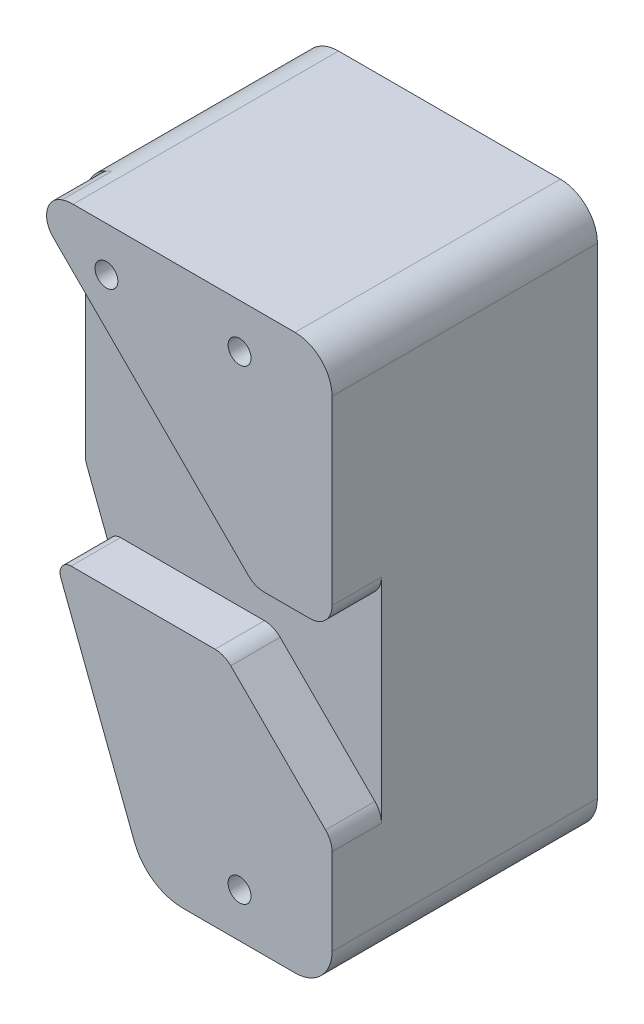
from build123d import *
from build123d.topology import SkipClean

# Parameters (mm, degrees)
SKETCH1_R           = 1.5
SKETCH1_W           = 15
SKETCH1_H           = 37.5
BOSS_EXTRUDE1_DEPTH = 2.85
FILLET1_R           = 5
FILLET2_R           = 2
BOSS_EXTRUDE2_START = 3.5
SKETCH5_R           = 1.5
BOSS_EXTRUDE2_DEPTH = 3.5
FILLET3_R           = 3.5
FILLET4_R           = 2
FILLET5_R           = 2
SKETCH6_R           = 1.5
CUT_EXTRUDE1_DEPTH  = 10
SKETCH8_R           = 1.5
BOSS_EXTRUDE3_DEPTH = 6.35
BOSS_EXTRUDE4_START = 3.175
SKETCH9_R           = 1.5
BOSS_EXTRUDE4_DEPTH = 3.175
SKETCH10_W          = 40
SKETCH10_H          = 15.399494937
SKETCH10_W_2        = 25
BOSS_EXTRUDE5_DEPTH = 6.675
CUT_EXTRUDE2_START  = -6.675
CUT_EXTRUDE2_DEPTH  = 6.675
BOSS_EXTRUDE6_START = -9.2
BOSS_EXTRUDE6_DEPTH = 9.2
FILLET6_R           = 7
BOSS_EXTRUDE7_DEPTH = 6.675
FILLET7_R           = 3
FILLET8_R           = 1.5
SKETCH14_R          = 1.5
CUT_EXTRUDE3_DEPTH  = 81.63507689
SKETCH15_R          = 1.55
CUT_EXTRUDE4_DEPTH  = 81.63507689
BOSS_EXTRUDE8_START = 20
SKETCH16_R          = 1.55
BOSS_EXTRUDE8_DEPTH = 20


# Read off the part's stored shape, not the designer's step: Cut-Extrude2
with BuildPart() as part:
    # Sketch1 → Boss-Extrude1 (new body)
    # profile 1 of 2: a face of its own
    with BuildSketch(Plane.XY):
        Polygon((0, 37.5), (0, 0), (25, 0), (25, 75), (0, 75), align=None)
        with Locations((12.5, 6)):
            Circle(SKETCH1_R, mode=Mode.SUBTRACT)
        with Locations((12.5, 37.5)):
            Circle(SKETCH1_R, mode=Mode.SUBTRACT)
        with Locations((12.5, 69)):
            Circle(SKETCH1_R, mode=Mode.SUBTRACT)
    # profile 2 of 2: a face of its own
    with BuildSketch(Plane.XY):
        with Locations((-7.5, 56.25)):
            Rectangle(SKETCH1_W, SKETCH1_H)
    extrude(amount=BOSS_EXTRUDE1_DEPTH)

    # Fillet1
    fillet1_edges = [part.edges().sort_by_distance(p)[0] for p in [
        (25, 75, 1.425),
        (25, 0, 1.425),
        (0, 0, 1.425),
        (0, 37.5, 1.425),
        (-15, 75, 1.425),
    ]]
    fillet(fillet1_edges, radius=FILLET1_R)

    # Fillet2
    fillet2_edges = [part.edges().sort_by_distance(p)[0] for p in [
        (-15, 37.5, 1.425),
    ]]
    fillet(fillet2_edges, radius=FILLET2_R)

    # Sketch5 → Boss-Extrude2 (add)
    # profile 1 of 2: a face of its own
    with BuildSketch(Plane.XY.offset(2.85).offset(BOSS_EXTRUDE2_START)):
        with BuildLine():
            Line((-15, 42.5), (10.428932188, 42.5))
            Line((10.428932188, 42.5), (21.464466094, 53.535533906))
            Line((21.464466094, 53.535533906), (25, 57.071067812))
            Line((25, 57.071067812), (25, 70))
            ThreePointArc((25, 70), (23.535533906, 73.535533906), (20, 75))
            Line((20, 75), (-10, 75))
            ThreePointArc((-10, 75), (-13.535533906, 73.535533906), (-15, 70))
            Line((-15, 70), (-15, 42.5))
        make_face()
        with Locations((12.5, 69)):
            Circle(SKETCH5_R, mode=Mode.SUBTRACT)
    # profile 2 of 2: a face of its own
    with BuildSketch(Plane.XY.offset(2.85).offset(BOSS_EXTRUDE2_START)):
        with BuildLine():
            Line((14.571067812, 32.5), (0, 17.928932188))
            Line((0, 17.928932188), (0, 5))
            ThreePointArc((0, 5), (1.464466094, 1.464466094), (5, 0))
            Line((5, 0), (20, 0))
            ThreePointArc((20, 0), (23.535533906, 1.464466094), (25, 5))
            Line((25, 5), (25, 32.5))
            Line((25, 32.5), (14.571067812, 32.5))
        make_face()
        with Locations((12.5, 6)):
            Circle(SKETCH5_R, mode=Mode.SUBTRACT)
    extrude(amount=-BOSS_EXTRUDE2_DEPTH)

    # Fillet3
    fillet3_edges = [part.edges().sort_by_distance(p)[0] for p in [
        (10.428932188, 42.5, 4.6),
        (14.571067812, 32.5, 4.6),
    ]]
    fillet(fillet3_edges, radius=FILLET3_R)

    # Fillet4
    fillet4_edges = [part.edges().sort_by_distance(p)[0] for p in [
        (-15, 42.5, 4.6),
    ]]
    fillet(fillet4_edges, radius=FILLET4_R)

    # Fillet5
    fillet5_edges = [part.edges().sort_by_distance(p)[0] for p in [
        (25, 57.071067812, 4.6),
        (25, 32.5, 4.6),
        (0, 17.928932188, 4.6),
    ]]
    fillet(fillet5_edges, radius=FILLET5_R)

    # Sketch6 → Cut-Extrude1 (cut)
    with BuildSketch(Plane.XY.offset(6.35)):
        with Locations((-5.5, 69)):
            Circle(SKETCH6_R)
    extrude(amount=-CUT_EXTRUDE1_DEPTH, mode=Mode.SUBTRACT)

    # Sketch8 → Boss-Extrude3 (add)
    with SkipClean():  # the faces are left unmerged after this step: merging them gives an invalid solid
        with BuildSketch(Plane(origin=(0, 0, 0), x_dir=(-1, 0, 0), z_dir=(0, 0, -1))):
            with BuildLine():
                ThreePointArc((0, 32.5), (1.464466094, 36.035533906), (5, 37.5))
                Line((5, 37.5), (13, 37.5))
                ThreePointArc((13, 37.5), (14.414213562, 38.085786438), (15, 39.5))
                Line((15, 39.5), (15, 70))
                ThreePointArc((15, 70), (13.535533906, 73.535533906), (10, 75))
                Line((10, 75), (-20, 75))
                ThreePointArc((-20, 75), (-23.535533906, 73.535533906), (-25, 70))
                Line((-25, 70), (-25, 5))
                ThreePointArc((-25, 5), (-23.535533906, 1.464466094), (-20, 0))
                Line((-20, 0), (-5, 0))
                ThreePointArc((-5, 0), (-1.464466094, 1.464466094), (0, 5))
                Line((0, 5), (0, 32.5))
            make_face()
            with Locations((-12.5, 6)):
                Circle(SKETCH8_R, mode=Mode.SUBTRACT)
            with Locations((-12.5, 69)):
                Circle(SKETCH8_R, mode=Mode.SUBTRACT)
            with Locations((-12.5, 37.5)):
                Circle(SKETCH8_R, mode=Mode.SUBTRACT)
            with Locations(Location((5.5, 69, 0), (0, 0, 180))):
                Circle(SKETCH8_R, mode=Mode.SUBTRACT)
        extrude(amount=BOSS_EXTRUDE3_DEPTH)
    add(part.part.scale(1), mode=Mode.REPLACE)  # the faces are merged on a copy

    # Sketch9 → Boss-Extrude4 (add)
    # profile 1 of 2: a face of its own
    with BuildSketch(Plane.XY.offset(6.35).offset(BOSS_EXTRUDE4_START)):
        with BuildLine():
            ThreePointArc((16.02081528, 32.5), (14.681423267, 32.233578364), (13.545941546, 31.474873734))
            Line((13.545941546, 31.474873734), (0.585786438, 18.514718626))
            ThreePointArc((0.585786438, 18.514718626), (0.152240935, 17.865871928), (0, 17.100505063))
            Line((0, 17.100505063), (0, 5))
            ThreePointArc((0, 5), (1.464466094, 1.464466094), (5, 0))
            Line((5, 0), (20, 0))
            ThreePointArc((20, 0), (23.535533906, 1.464466094), (25, 5))
            Line((25, 5), (25, 30.5))
            ThreePointArc((25, 30.5), (24.414213562, 31.914213562), (23, 32.5))
            Line((23, 32.5), (16.02081528, 32.5))
        make_face()
    # profile 2 of 2: a face of its own
    with BuildSketch(Plane.XY.offset(6.35).offset(BOSS_EXTRUDE4_START)):
        with BuildLine():
            ThreePointArc((8.97918472, 42.5), (10.318576733, 42.766421636), (11.454058454, 43.525126266))
            Line((11.454058454, 43.525126266), (24.414213562, 56.485281374))
            ThreePointArc((24.414213562, 56.485281374), (24.847759065, 57.134128072), (25, 57.899494937))
            Line((25, 57.899494937), (25, 70))
            ThreePointArc((25, 70), (23.535533906, 73.535533906), (20, 75))
            Line((20, 75), (-10, 75))
            ThreePointArc((-10, 75), (-13.535533906, 73.535533906), (-15, 70))
            Line((-15, 70), (-15, 44.5))
            ThreePointArc((-15, 44.5), (-14.414213562, 43.085786438), (-13, 42.5))
            Line((-13, 42.5), (8.97918472, 42.5))
        make_face()
        with Locations((-5.5, 69)):
            Circle(SKETCH9_R, mode=Mode.SUBTRACT)
        with Locations((12.5, 69)):
            Circle(SKETCH9_R, mode=Mode.SUBTRACT)
    extrude(amount=-BOSS_EXTRUDE4_DEPTH)

    # Sketch10 → Boss-Extrude5 (add)
    with SkipClean():  # the faces are left unmerged after this step: merging them gives an invalid solid
        with BuildSketch(Plane.XY.offset(9.525)):
            with Locations((5, 50.199747469)):
                Rectangle(SKETCH10_W, SKETCH10_H)
            with Locations((12.5, 24.800252531)):
                Rectangle(SKETCH10_W_2, SKETCH10_H)
        extrude(amount=-BOSS_EXTRUDE5_DEPTH)

    # Cut-Extrude2 outline → Cut-Extrude2 (cut)
    with SkipClean():  # the faces are left unmerged after this step: merging them gives an invalid solid
        with BuildSketch(Plane.XY.offset(9.525).offset(CUT_EXTRUDE2_START)):
            Polygon((25, 32.5), (10.428932188, 32.5), (25, 17.928932188), align=None)
            with BuildLine():
                Line((-15, 42.5), (14.571067812, 42.5))
                Line((14.571067812, 42.5), (-14.682437359, 71.75350517))
                ThreePointArc((-14.682437359, 71.75350517), (-14.919968841, 70.891014367), (-15, 70))
                Line((-15, 70), (-15, 42.5))
            make_face()
        extrude(amount=CUT_EXTRUDE2_DEPTH, mode=Mode.SUBTRACT)

    # Sketch12 → Boss-Extrude6 (add)
    with BuildSketch(Plane(origin=(0, 0, -6.35), x_dir=(-1, 0, 0), z_dir=(0, 0, -1)).offset(BOSS_EXTRUDE6_START)):
        with BuildLine():
            Line((0, 0), (14.867488321, 38.784117768))
            ThreePointArc((14.867488321, 38.784117768), (14.133189202, 37.852006604), (13, 37.5))
            Line((13, 37.5), (5, 37.5))
            ThreePointArc((5, 37.5), (1.464466094, 36.035533906), (0, 32.5))
            Line((0, 32.5), (0, 5))
            ThreePointArc((0, 5), (-1.464466094, 1.464466094), (-5, 0))
            Line((-5, 0), (0, 0))
        make_face()
    extrude(amount=BOSS_EXTRUDE6_DEPTH)

    # Fillet6
    fillet6_edges = [part.edges().sort_by_distance(p)[0] for p in [
        (0, 0, -1.75),
    ]]
    fillet(fillet6_edges, radius=FILLET6_R)

    # Sketch13 → Boss-Extrude7 (add)
    with SkipClean():  # the faces are left unmerged after this step: merging them gives an invalid solid
        with BuildSketch(Plane.XY.offset(9.525)):
            with BuildLine():
                Line((0, 32.5), (0, 5))
                ThreePointArc((0, 5), (1.464466094, 1.464466094), (5, 0))
                Line((5, 0), (4.813322939, 0))
                ThreePointArc((4.813322939, 0), (0.847160732, 1.232023115), (-1.722886185, 4.494412187))
                Line((-1.722886185, 4.494412187), (-12.458537109, 32.5))
                Line((-12.458537109, 32.5), (0, 32.5))
            make_face()
        extrude(amount=-BOSS_EXTRUDE7_DEPTH)

    # Fillet7
    fillet7_edges = [part.edges().sort_by_distance(p)[0] for p in [
        (25, 42.5, 6.1875),
        (14.571067812, 42.5, 6.1875),
        (-14.682437359, 71.75350517, 4.6),
        (10.428932188, 32.5, 6.1875),
        (25, 17.928932188, 6.1875),
    ]]
    fillet(fillet7_edges, radius=FILLET7_R)

    # Fillet8
    # the kernel refuses this fillet: 1.5 mm, written as the material it takes off along each edge
    with BuildSketch(Plane(origin=(-12.458537109, 32.5, 14.978612885), x_dir=(0.35794111613384066, -0.9337441605605148, 0), z_dir=(0, 0, -1))) as fillet8_piece_1:
        with BuildLine():
            CenterArc((FILLET8_R * 1.45429676938, -FILLET8_R), FILLET8_R, 90, 110.97380664)
            Line((FILLET8_R * 0.520552608823, -FILLET8_R * 1.35794111613), (0, 0))
            Line((0, 0), (FILLET8_R * 1.45429676938, 0))
        make_face()
    extrude(amount=12.128612885, mode=Mode.SUBTRACT)

    # Sketch14 → Cut-Extrude3 (cut, through all)
    with SkipClean():  # the faces are left unmerged after this step: merging them gives an invalid solid
        with BuildSketch(Plane(origin=(0, 0, -6.35), x_dir=(-1, 0, 0), z_dir=(0, 0, -1))):
            with Locations((-12.5, 6)):
                Circle(SKETCH14_R)
        extrude(amount=-CUT_EXTRUDE3_DEPTH, mode=Mode.SUBTRACT)
    add(part.part.scale(1), mode=Mode.REPLACE)  # the faces are merged on a copy

    # Sketch15 → Cut-Extrude4 (cut, through all)
    with BuildSketch(Plane(origin=(0, 0, -6.35), x_dir=(-1, 0, 0), z_dir=(0, 0, -1))):
        with Locations((-12.5, 69)):
            Circle(SKETCH15_R)
        with Locations((5.5, 69)):
            Circle(SKETCH15_R)
        with Locations((-12.5, 37.5)):
            Circle(SKETCH15_R)
        with Locations((-12.5, 6)):
            Circle(SKETCH15_R)
    extrude(amount=-CUT_EXTRUDE4_DEPTH, mode=Mode.SUBTRACT)

    # Sketch16 → Boss-Extrude8 (add)
    with BuildSketch(Plane(origin=(0, 0, -6.35), x_dir=(-1, 0, 0), z_dir=(0, 0, -1)).offset(BOSS_EXTRUDE8_START)):
        with BuildLine():
            Line((-20, 0), (-4.813322939, 0))
            ThreePointArc((-4.813322939, 0), (-0.847160732, 1.232023115), (1.722886185, 4.494412187))
            Line((1.722886185, 4.494412187), (14.867488321, 38.784117768))
            ThreePointArc((14.867488321, 38.784117768), (14.966593075, 39.135978464), (15, 39.5))
            Line((15, 39.5), (15, 70))
            ThreePointArc((15, 70), (13.535533906, 73.535533906), (10, 75))
            Line((10, 75), (-20, 75))
            ThreePointArc((-20, 75), (-23.535533906, 73.535533906), (-25, 70))
            Line((-25, 70), (-25, 5))
            ThreePointArc((-25, 5), (-23.535533906, 1.464466094), (-20, 0))
        make_face()
        with Locations((-12.5, 6)):
            Circle(SKETCH16_R, mode=Mode.SUBTRACT)
        with Locations((-12.5, 37.5)):
            Circle(SKETCH16_R, mode=Mode.SUBTRACT)
        with Locations((5.5, 69)):
            Circle(SKETCH16_R, mode=Mode.SUBTRACT)
        with Locations((-12.5, 69)):
            Circle(SKETCH16_R, mode=Mode.SUBTRACT)
    extrude(amount=-BOSS_EXTRUDE8_DEPTH)


solid = part.part
